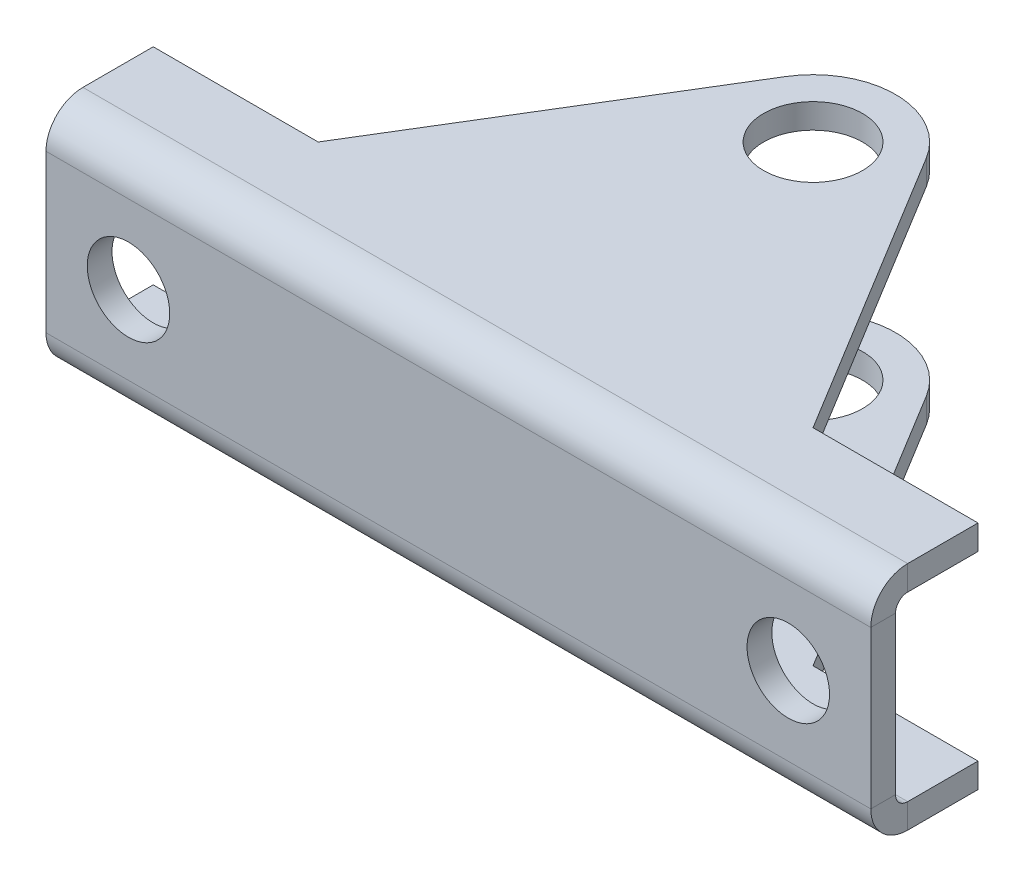
from build123d import *

# Parameters (mm, degrees)
SKETCH1_W                      = 50
SKETCH1_H                      = 11
SKETCH1_R                      = 2.5
BASE_FLANGE1_DEPTH             = 1.5
EDGE_FLANGE1_STRIP_W           = 7.4732
EDGE_FLANGE1_STRIP_H           = 1.5
EDGE_FLANGE1_STRIP_CUT_DEPTH   = 50
EDGE_FLANGE1_STRIP_2_W         = 7.4732
EDGE_FLANGE1_STRIP_2_H         = 1.5
EDGE_FLANGE1_STRIP_CUT_2_DEPTH = 50
EDGE_FLANGE1_DEPTH             = 50
EDGE_FLANGE1_BEND_DEPTH        = 50
SKETCH10_R                     = 3
TAB2_DEPTH                     = 1.5


# Sheet-metal steps are written as plain solids
with BuildPart() as part:
    # Sketch1 → Base-Flange1 (new body)
    with BuildSketch(Plane.XY):
        Rectangle(SKETCH1_W, SKETCH1_H)
        with Locations((-20, 0)):
            Circle(SKETCH1_R, mode=Mode.SUBTRACT)
        with Locations((20, 0)):
            Circle(SKETCH1_R, mode=Mode.SUBTRACT)
    extrude(amount=-BASE_FLANGE1_DEPTH)

    # Edge-Flange1 strip (across the edge) → Edge-Flange1 strip cut (cut)
    with BuildSketch(Plane(origin=(-25, 5.5, -1.5), x_dir=(0, -1, 0), z_dir=(1, 0, 0))):
        with Locations((-3, -0.75)):
            Rectangle(EDGE_FLANGE1_STRIP_W, EDGE_FLANGE1_STRIP_H)
    extrude(amount=EDGE_FLANGE1_STRIP_CUT_DEPTH, mode=Mode.SUBTRACT)

    # Edge-Flange1 strip 2 (across the edge) → Edge-Flange1 strip cut 2 (cut)
    with BuildSketch(Plane(origin=(25, -5.5, -1.5), x_dir=(0, 1, 0), z_dir=(-1, 0, 0))):
        with Locations((-3, -0.75)):
            Rectangle(EDGE_FLANGE1_STRIP_2_W, EDGE_FLANGE1_STRIP_2_H)
    extrude(amount=EDGE_FLANGE1_STRIP_CUT_2_DEPTH, mode=Mode.SUBTRACT)

    # Edge-Flange1 section (across the edge) → Edge-Flange1 (add)
    with BuildSketch(Plane(origin=(-25, 5.5, -1.5), x_dir=(0, -1, 0), z_dir=(1, 0, 0))):
        with BuildLine():
            Line((-1.5, 0.7366), (-1.5, 5))
            Line((-1.5, 5), (0, 5))
            Line((0, 5), (0, 0.7366))
            ThreePointArc((0, 0.7366), (0.215745145, 0.215745145), (0.7366, 0))
            Line((0.7366, 0), (0.7366, -1.5))
            ThreePointArc((0.7366, -1.5), (-0.844915027, -0.844915027), (-1.5, 0.7366))
        make_face()
    extrude(amount=EDGE_FLANGE1_DEPTH)

    # Edge-Flange1 section 2 (across the edge) → Edge-Flange1 bend (add)
    with BuildSketch(Plane(origin=(25, -5.5, -1.5), x_dir=(0, 1, 0), z_dir=(-1, 0, 0))):
        with BuildLine():
            Line((-1.5, 0.7366), (-1.5, 5))
            Line((-1.5, 5), (0, 5))
            Line((0, 5), (0, 0.7366))
            ThreePointArc((0, 0.7366), (0.215745145, 0.215745145), (0.7366, 0))
            Line((0.7366, 0), (0.7366, -1.5))
            ThreePointArc((0.7366, -1.5), (-0.844915027, -0.844915027), (-1.5, 0.7366))
        make_face()
    extrude(amount=EDGE_FLANGE1_BEND_DEPTH)

    # Sketch10 → Tab2 (add)
    with BuildSketch(Plane(origin=(0, 7, 0), x_dir=(1, 0, 0), z_dir=(0, 1, 0))):
        with BuildLine():
            Line((-15, 6.5), (-4.269254688, 24.102588021))
            ThreePointArc((-4.269254688, 24.102588021), (0, 26.5), (4.269254688, 24.102588021))
            Line((4.269254688, 24.102588021), (15, 6.5))
            Line((15, 6.5), (-15, 6.5))
        make_face()
        with Locations(Location((0, 21.5, 0), (0, 0, 270))):
            Circle(SKETCH10_R, mode=Mode.SUBTRACT)
    tab2 = extrude(amount=-TAB2_DEPTH)

    # Mirror1: Tab2 across plane
    add(tab2.mirror(Plane.ZX))


solid = part.part
